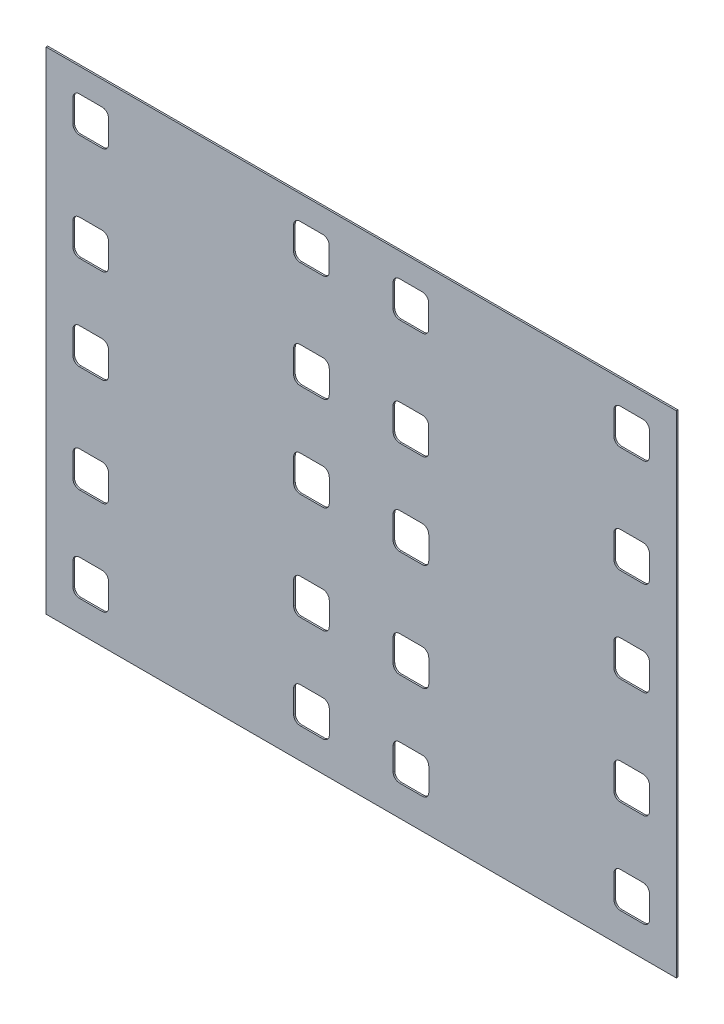
from build123d import *

# Parameters (mm, degrees)
BOSS_EXTRUDE2_DEPTH  = 1.5875
CUT_EXTRUDE6_DEPTH   = 570.657128967
LPATTERN2_COUNT      = 2
LPATTERN2_PITCH      = 217.5764
MIRROR1_COPY_1_DEPTH = 570.657128967


with BuildPart() as part:
    # Sketch9 → Boss-Extrude2 (new body)
    with BuildSketch(Plane.XY):
        Polygon((-144.32459706, -311.513538284), (476.933999514, -311.448288512), (476.883139425, 172.802708817), (-144.375457148, 172.737459045), align=None)
    extrude(amount=BOSS_EXTRUDE2_DEPTH)

    # Sketch10 → Cut-Extrude6 (cut, through all)
    with BuildSketch(Plane.XY.offset(1.5875)):
        with BuildLine():
            ThreePointArc((-111.536959772, -153.814293782), (-116.026892468, -155.674637302), (-117.886292807, -160.164960677))
            Line((-117.886292807, -160.164960677), (-117.883937231, -182.592960554))
            ThreePointArc((-117.883937231, -182.592960554), (-116.023593711, -187.08289325), (-111.533270336, -188.942293589))
            Line((-111.533270336, -188.942293589), (-89.105270459, -188.939938013))
            ThreePointArc((-89.105270459, -188.939938013), (-84.615337763, -187.079594493), (-82.755937424, -182.589271117))
            Line((-82.755937424, -182.589271117), (-82.758293, -160.161271241))
            ThreePointArc((-82.758293, -160.161271241), (-84.61863652, -155.671338545), (-89.108959895, -153.811938206))
            Line((-89.108959895, -153.811938206), (-111.536959772, -153.814293782))
        make_face()
        with BuildLine():
            ThreePointArc((-111.527235931, -246.397293272), (-116.017168628, -248.257636792), (-117.876568966, -252.747960167))
            Line((-117.876568966, -252.747960167), (-117.87421339, -275.175960043))
            ThreePointArc((-117.87421339, -275.175960043), (-116.01386987, -279.665892739), (-111.523546495, -281.525293078))
            Line((-111.523546495, -281.525293078), (-89.095546619, -281.522937502))
            ThreePointArc((-89.095546619, -281.522937502), (-84.605613922, -279.662593982), (-82.746213584, -275.172270607))
            Line((-82.746213584, -275.172270607), (-82.74856916, -252.74427073))
            ThreePointArc((-82.74856916, -252.74427073), (-84.60891268, -248.254338034), (-89.099236055, -246.394937696))
            Line((-89.099236055, -246.394937696), (-111.527235931, -246.397293272))
        make_face()
        with BuildLine():
            ThreePointArc((-82.769334695, -55.030671821), (-84.629678215, -50.540739125), (-89.12000159, -48.681338786))
            Line((-89.12000159, -48.681338786), (-111.548001466, -48.683694362))
            ThreePointArc((-111.548001466, -48.683694362), (-116.037934163, -50.544037882), (-117.897334501, -55.034361257))
            Line((-117.897334501, -55.034361257), (-117.894978925, -77.462361134))
            ThreePointArc((-117.894978925, -77.462361134), (-116.034635405, -81.95229383), (-111.54431203, -83.811694168))
            Line((-111.54431203, -83.811694168), (-89.116312154, -83.809338592))
            ThreePointArc((-89.116312154, -83.809338592), (-84.626379457, -81.948995072), (-82.766979119, -77.458671697))
            Line((-82.766979119, -77.458671697), (-82.769334695, -55.030671821))
        make_face()
        with BuildLine():
            ThreePointArc((-89.137077689, 113.904260317), (-84.647144992, 115.764603837), (-82.787744654, 120.254927212))
            Line((-82.787744654, 120.254927212), (-82.79010023, 142.682927089))
            ThreePointArc((-82.79010023, 142.682927089), (-84.65044375, 147.172859785), (-89.140767125, 149.032260123))
            Line((-89.140767125, 149.032260123), (-111.568767001, 149.029904547))
            ThreePointArc((-111.568767001, 149.029904547), (-116.058699698, 147.169561027), (-117.918100036, 142.679237652))
            Line((-117.918100036, 142.679237652), (-117.91574446, 120.251237776))
            ThreePointArc((-117.91574446, 120.251237776), (-116.05540094, 115.76130508), (-111.565077565, 113.901904741))
            Line((-111.565077565, 113.901904741), (-89.137077689, 113.904260317))
        make_face()
        with BuildLine():
            ThreePointArc((-117.904702766, 15.120638356), (-116.044359246, 10.630705659), (-111.554035871, 8.771305321))
            Line((-111.554035871, 8.771305321), (-89.126035994, 8.773660897))
            ThreePointArc((-89.126035994, 8.773660897), (-84.636103298, 10.634004417), (-82.77670296, 15.124327792))
            Line((-82.77670296, 15.124327792), (-82.779058536, 37.552327668))
            ThreePointArc((-82.779058536, 37.552327668), (-84.639402056, 42.042260365), (-89.129725431, 43.901660703))
            Line((-89.129725431, 43.901660703), (-111.557725307, 43.899305127))
            ThreePointArc((-111.557725307, 43.899305127), (-116.047658003, 42.038961607), (-117.907058342, 37.548638232))
            Line((-117.907058342, 37.548638232), (-117.904702766, 15.120638356))
        make_face()
    cut_extrude6 = extrude(amount=-CUT_EXTRUDE6_DEPTH, mode=Mode.SUBTRACT)

    # LPattern2: Cut-Extrude6 ×2
    with Locations(*[Vector(0.9999999944845218, 0.0001050283601130813, 0) * (i * LPATTERN2_PITCH) for i in range(1, LPATTERN2_COUNT)]):
        add(cut_extrude6, mode=Mode.SUBTRACT)

    # Mirror1: Cut-Extrude6 across plane
    add(cut_extrude6.mirror(Plane(origin=(166.271985063, 0.017463274, 0), x_dir=(0, 0, 1), z_dir=(-0.9999999944845219, -0.00010502836011320445, 0))), mode=Mode.SUBTRACT)

    # Mirror1 copy 1 sketch → Mirror1 copy 1 (cut, through all)
    with BuildSketch(Plane(origin=(114.967571327, 0.012074856, 1.5875), x_dir=(-0.9999999779380877, -0.00021005671906784565, 0), z_dir=(0, 0, 1))):
        with BuildLine():
            ThreePointArc((-111.536959772, 153.814293782), (-116.026892468, 155.674637302), (-117.886292807, 160.164960677))
            Line((-117.886292807, 160.164960677), (-117.883937231, 182.592960554))
            ThreePointArc((-117.883937231, 182.592960554), (-116.023593711, 187.08289325), (-111.533270336, 188.942293589))
            Line((-111.533270336, 188.942293589), (-89.105270459, 188.939938013))
            ThreePointArc((-89.105270459, 188.939938013), (-84.615337763, 187.079594493), (-82.755937424, 182.589271117))
            Line((-82.755937424, 182.589271117), (-82.758293, 160.161271241))
            ThreePointArc((-82.758293, 160.161271241), (-84.61863652, 155.671338545), (-89.108959895, 153.811938206))
            Line((-89.108959895, 153.811938206), (-111.536959772, 153.814293782))
        make_face()
        with BuildLine():
            ThreePointArc((-111.527235931, 246.397293272), (-116.017168628, 248.257636792), (-117.876568966, 252.747960167))
            Line((-117.876568966, 252.747960167), (-117.87421339, 275.175960043))
            ThreePointArc((-117.87421339, 275.175960043), (-116.01386987, 279.665892739), (-111.523546495, 281.525293078))
            Line((-111.523546495, 281.525293078), (-89.095546619, 281.522937502))
            ThreePointArc((-89.095546619, 281.522937502), (-84.605613922, 279.662593982), (-82.746213584, 275.172270607))
            Line((-82.746213584, 275.172270607), (-82.74856916, 252.74427073))
            ThreePointArc((-82.74856916, 252.74427073), (-84.60891268, 248.254338034), (-89.099236055, 246.394937696))
            Line((-89.099236055, 246.394937696), (-111.527235931, 246.397293272))
        make_face()
        with BuildLine():
            ThreePointArc((-82.769334695, 55.030671821), (-84.629678215, 50.540739125), (-89.12000159, 48.681338786))
            Line((-89.12000159, 48.681338786), (-111.548001466, 48.683694362))
            ThreePointArc((-111.548001466, 48.683694362), (-116.037934163, 50.544037882), (-117.897334501, 55.034361257))
            Line((-117.897334501, 55.034361257), (-117.894978925, 77.462361134))
            ThreePointArc((-117.894978925, 77.462361134), (-116.034635405, 81.95229383), (-111.54431203, 83.811694168))
            Line((-111.54431203, 83.811694168), (-89.116312154, 83.809338592))
            ThreePointArc((-89.116312154, 83.809338592), (-84.626379457, 81.948995072), (-82.766979119, 77.458671697))
            Line((-82.766979119, 77.458671697), (-82.769334695, 55.030671821))
        make_face()
        with BuildLine():
            ThreePointArc((-89.137077689, -113.904260317), (-84.647144992, -115.764603837), (-82.787744654, -120.254927212))
            Line((-82.787744654, -120.254927212), (-82.79010023, -142.682927089))
            ThreePointArc((-82.79010023, -142.682927089), (-84.65044375, -147.172859785), (-89.140767125, -149.032260123))
            Line((-89.140767125, -149.032260123), (-111.568767001, -149.029904547))
            ThreePointArc((-111.568767001, -149.029904547), (-116.058699698, -147.169561027), (-117.918100036, -142.679237652))
            Line((-117.918100036, -142.679237652), (-117.91574446, -120.251237776))
            ThreePointArc((-117.91574446, -120.251237776), (-116.05540094, -115.76130508), (-111.565077565, -113.901904741))
            Line((-111.565077565, -113.901904741), (-89.137077689, -113.904260317))
        make_face()
        with BuildLine():
            ThreePointArc((-117.904702766, -15.120638356), (-116.044359246, -10.630705659), (-111.554035871, -8.771305321))
            Line((-111.554035871, -8.771305321), (-89.126035994, -8.773660897))
            ThreePointArc((-89.126035994, -8.773660897), (-84.636103298, -10.634004417), (-82.77670296, -15.124327792))
            Line((-82.77670296, -15.124327792), (-82.779058536, -37.552327668))
            ThreePointArc((-82.779058536, -37.552327668), (-84.639402056, -42.042260365), (-89.129725431, -43.901660703))
            Line((-89.129725431, -43.901660703), (-111.557725307, -43.899305127))
            ThreePointArc((-111.557725307, -43.899305127), (-116.047658003, -42.038961607), (-117.907058342, -37.548638232))
            Line((-117.907058342, -37.548638232), (-117.904702766, -15.120638356))
        make_face()
    extrude(amount=-MIRROR1_COPY_1_DEPTH, mode=Mode.SUBTRACT)


solid = part.part
